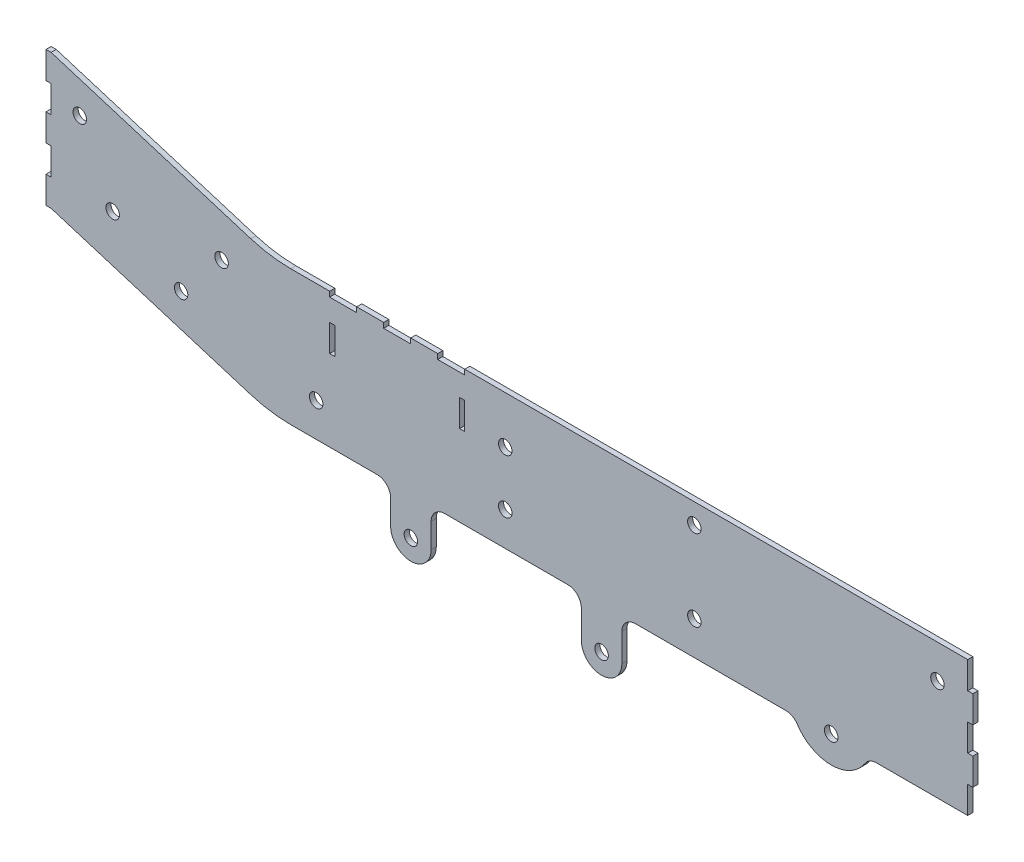
from build123d import *

# Parameters (mm, degrees)
SKETCH2_R                           = 6.35
BASE_DEPTH                          = 4.826
SKETCH3_W                           = 4.826
SKETCH3_H                           = 25.4
CENTER_SUPPORT_VERTICAL_HOLES_DEPTH = 715.644290324
SKETCH4_W                           = 4.826
SKETCH4_H                           = 25.4
CUT_EXTRUDE2_DEPTH                  = 9.652


with BuildPart() as part:
    # Sketch2 → base (new body)
    with BuildSketch(Plane.XY):
        with BuildLine():
            Line((-214.699698696, -160.199792202), (-26.873942154, -218.069670807))
            ThreePointArc((-26.873942154, -218.069670807), (-8.387395977, -222.284374422), (10.520610491, -223.699792202))
            Line((10.520610491, -223.699792202), (91.809301303, -223.699792202))
            ThreePointArc((91.809301303, -223.699792202), (100.789557424, -227.419536081), (104.509301303, -236.399792202))
            Line((104.509301303, -236.399792202), (104.509301303, -259.444792203))
            ThreePointArc((104.509301303, -259.444792203), (123.559301303, -278.494792203), (142.609301303, -259.444792203))
            Line((142.609301303, -259.444792203), (142.609301303, -236.399792202))
            ThreePointArc((142.609301303, -236.399792202), (146.329045182, -227.419536081), (155.309301303, -223.699792202))
            Line((155.309301303, -223.699792202), (271.099301303, -223.699792202))
            ThreePointArc((271.099301303, -223.699792202), (280.079557424, -227.419536081), (283.799301303, -236.399792202))
            Line((283.799301303, -236.399792202), (283.799301303, -262.624792203))
            ThreePointArc((283.799301303, -262.624792203), (302.849301303, -281.674792203), (321.899301303, -262.624792203))
            Line((321.899301303, -262.624792203), (321.899301303, -236.399792202))
            ThreePointArc((321.899301303, -236.399792202), (325.619045182, -227.419536081), (334.599301303, -223.699792202))
            Line((334.599301303, -223.699792202), (476.201681216, -223.699792202))
            ThreePointArc((476.201681216, -223.699792202), (482.250146931, -225.232605336), (486.838586238, -229.461042202))
            ThreePointArc((486.838586238, -229.461042202), (518.749301303, -246.744792203), (550.660016368, -229.461042202))
            ThreePointArc((550.660016368, -229.461042202), (555.248455675, -225.232605336), (561.29692139, -223.699792202))
            Line((561.29692139, -223.699792202), (656.774301304, -223.699792202))
            Line((656.774301304, -223.699792202), (656.774301304, -198.299792202))
            Line((656.774301304, -198.299792202), (651.948301304, -198.299792202))
            Line((651.948301304, -198.299792202), (651.948301304, -172.899792202))
            Line((651.948301304, -172.899792202), (656.774301304, -172.899792202))
            Line((656.774301304, -172.899792202), (656.774301304, -147.499792202))
            Line((656.774301304, -147.499792202), (651.948301304, -147.499792202))
            Line((651.948301304, -147.499792202), (651.948301304, -122.099792202))
            Line((651.948301304, -122.099792202), (656.774301304, -122.099792202))
            Line((656.774301304, -122.099792202), (656.774301304, -96.699792202))
            Line((656.774301304, -96.699792202), (174.174301304, -96.699792202))
            Line((174.174301304, -96.699792202), (174.174301304, -101.525792202))
            Line((174.174301304, -101.525792202), (148.774301304, -101.525792202))
            Line((148.774301304, -101.525792202), (148.774301304, -96.699792202))
            Line((148.774301304, -96.699792202), (123.374301304, -96.699792202))
            Line((123.374301304, -96.699792202), (123.374301304, -101.525792202))
            Line((123.374301304, -101.525792202), (97.974301304, -101.525792202))
            Line((97.974301304, -101.525792202), (97.974301304, -96.699792202))
            Line((97.974301304, -96.699792202), (72.574301304, -96.699792202))
            Line((72.574301304, -96.699792202), (72.574301304, -101.525792202))
            Line((72.574301304, -101.525792202), (47.174301304, -101.525792202))
            Line((47.174301304, -101.525792202), (47.174301304, -96.699792202))
            Line((47.174301304, -96.699792202), (10.520610491, -96.699792202))
            ThreePointArc((10.520610491, -96.699792202), (-8.387395977, -95.284374422), (-26.873942154, -91.069670807))
            Line((-26.873942154, -91.069670807), (-214.699698696, -33.199792202))
            Line((-214.699698696, -33.199792202), (-219.525698696, -33.199792202))
            Line((-219.525698696, -33.199792202), (-219.525698696, -58.599792202))
            Line((-219.525698696, -58.599792202), (-214.699698696, -58.599792202))
            Line((-214.699698696, -58.599792202), (-214.699698696, -83.999792202))
            Line((-214.699698696, -83.999792202), (-219.525698696, -83.999792202))
            Line((-219.525698696, -83.999792202), (-219.525698696, -109.399792202))
            Line((-219.525698696, -109.399792202), (-214.699698696, -109.399792202))
            Line((-214.699698696, -109.399792202), (-214.699698696, -134.799792202))
            Line((-214.699698696, -134.799792202), (-219.525698696, -134.799792202))
            Line((-219.525698696, -134.799792202), (-219.525698696, -160.199792202))
            Line((-219.525698696, -160.199792202), (-214.699698696, -160.199792202))
        make_face()
        with Locations((390.074301304, -191.949792202)):
            Circle(SKETCH2_R, mode=Mode.SUBTRACT)
        with Locations((390.074301304, -115.749792202)):
            Circle(SKETCH2_R, mode=Mode.SUBTRACT)
        with Locations((518.749301303, -221.344792203)):
            Circle(SKETCH2_R, mode=Mode.SUBTRACT)
        with Locations((618.674301304, -128.449792202)):
            Circle(SKETCH2_R, mode=Mode.SUBTRACT)
        with Locations((302.849301303, -262.624792203)):
            Circle(SKETCH2_R, mode=Mode.SUBTRACT)
        with Locations((212.274301304, -191.949792202)):
            Circle(SKETCH2_R, mode=Mode.SUBTRACT)
        with Locations((212.274301304, -141.149792202)):
            Circle(SKETCH2_R, mode=Mode.SUBTRACT)
        with Locations((123.559301303, -259.444792203)):
            Circle(SKETCH2_R, mode=Mode.SUBTRACT)
        with Locations((34.474301304, -191.949792202)):
            Circle(SKETCH2_R, mode=Mode.SUBTRACT)
        with Locations((-92.525698696, -166.549792202)):
            Circle(SKETCH2_R, mode=Mode.SUBTRACT)
        with Locations((-156.850698697, -133.724792203)):
            Circle(SKETCH2_R, mode=Mode.SUBTRACT)
        with Locations((-54.425698696, -122.099792202)):
            Circle(SKETCH2_R, mode=Mode.SUBTRACT)
        with Locations((-187.775698696, -71.299792202)):
            Circle(SKETCH2_R, mode=Mode.SUBTRACT)
    extrude(amount=BASE_DEPTH)

    # Sketch3 → center support vertical holes (cut, through all)
    with BuildSketch(Plane.XY.offset(4.826)):
        with Locations((171.761301304, -134.799792202)):
            Rectangle(SKETCH3_W, SKETCH3_H)
        with Locations((49.587301304, -134.799792202)):
            Rectangle(SKETCH3_W, SKETCH3_H)
    extrude(amount=-CENTER_SUPPORT_VERTICAL_HOLES_DEPTH, mode=Mode.SUBTRACT)

    # Sketch4 → Cut-Extrude2 (cut)
    with BuildSketch(Plane(origin=(656.774301304, 0, 0), x_dir=(0, 0, -1), z_dir=(1, 0, 0))):
        with Locations((-2.413, -109.399792202)):
            Rectangle(SKETCH4_W, SKETCH4_H)
        with Locations((-2.413, -160.199792202)):
            Rectangle(SKETCH4_W, SKETCH4_H)
        with Locations((-2.413, -210.999792202)):
            Rectangle(SKETCH4_W, SKETCH4_H)
    extrude(amount=-CUT_EXTRUDE2_DEPTH, mode=Mode.SUBTRACT)


solid = part.part
